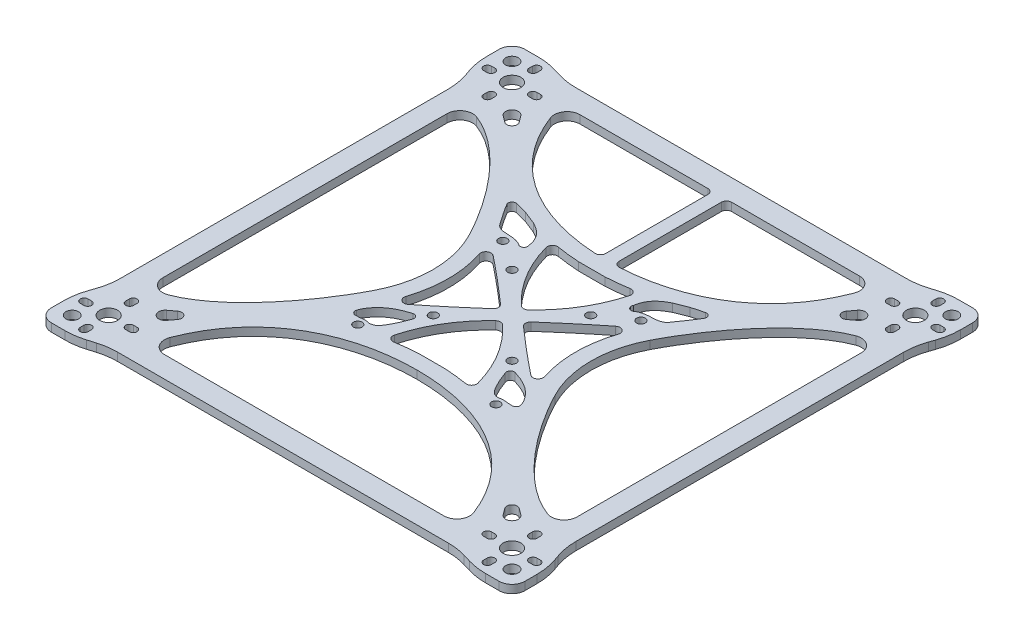
from build123d import *

# Parameters (mm, degrees)
SKETCH2_W                      = 183.5
SKETCH2_H                      = 183.5
BASE_SIZE_DEPTH                = 3.15
BASE_OUTLINE_AND_POCKETS_REACH = 131.792
MOTOR_HOLES_REACH              = 131.792
SKETCH4_R                      = 3.45
FC_HOLES_REACH                 = 131.792
SKETCH5_R                      = 1.675
SKETCH6_R                      = 2.45
SKETCH6_R_2                    = 2
MOTOR_WIRE_HOLES_DEPTH         = 3.15
LARGE_POCKET_FILLET_R          = 40
OUTSIDE_EDGE_FILLET_R          = 25
INNER_POCKET_FILLET_R          = 5
SMALL_POCKET_FILLET_R          = 2
INNER_START                    = -3.15
INNER_POCKETS_DEPTH            = 3.15
POCKET_FILLET_R                = 2


# Read off the part's stored shape, not the designer's step: Inner pockets
with BuildPart() as part:
    # Sketch2 → Base size (new body)
    with BuildSketch(Plane(origin=(0, 0, 0), x_dir=(1, 0, 0), z_dir=(0, 1, 0))):
        Rectangle(SKETCH2_W, SKETCH2_H)
    extrude(amount=BASE_SIZE_DEPTH)

    # Sketch3 → Base outline and pockets (cut, up to next)
    with BuildSketch(Plane(origin=(0, 3.15, 0), x_dir=(1, 0, 0), z_dir=(0, 1, 0)), mode=Mode.PRIVATE) as base_outline_and_pockets_sk1:
        with BuildLine():
            Line((-2.6, 36.790165742), (-2.6, 80.5))
            Line((-2.6, 80.5), (-61, 80.5))
            add(Edge.make_bspline(
                [(-61, 80.5), (-53.080820204, 50.565886756), (-28.566532025, 37.595544557), (-2.6, 36.790165742)],
                knots=[0, 0, 0, 0, 0.96775312, 0.96775312, 0.96775312, 0.96775312], degree=3))
        make_face()
    base_outline_and_pockets_tool1 = extrude(base_outline_and_pockets_sk1.sketch, amount=-BASE_OUTLINE_AND_POCKETS_REACH, mode=Mode.PRIVATE) & part.part
    # Sketch3 → Base outline and pockets (cut, up to next)
    with BuildSketch(Plane(origin=(0, 3.15, 0), x_dir=(1, 0, 0), z_dir=(0, 1, 0)), mode=Mode.PRIVATE) as base_outline_and_pockets_sk2:
        with BuildLine():
            add(Edge.make_bspline(
                [(61, 80.5), (53.080820204, 50.565886756), (28.566532025, 37.595544557), (2.6, 36.790165742)],
                knots=[0, 0, 0, 0, 0.96775312, 0.96775312, 0.96775312, 0.96775312], degree=3))
            Line((61, 80.5), (2.6, 80.5))
            Line((2.6, 80.5), (2.6, 36.790165742))
        make_face()
    base_outline_and_pockets_tool2 = extrude(base_outline_and_pockets_sk2.sketch, amount=-BASE_OUTLINE_AND_POCKETS_REACH, mode=Mode.PRIVATE) & part.part
    # Sketch3 → Base outline and pockets (cut, up to next)
    with BuildSketch(Plane(origin=(0, 3.15, 0), x_dir=(1, 0, 0), z_dir=(0, 1, 0)), mode=Mode.PRIVATE) as base_outline_and_pockets_sk3:
        Polygon((-77.75, 91.75), (-67.75, 88.75), (67.75, 88.75), (77.75, 91.75), align=None)
    base_outline_and_pockets_tool3 = extrude(base_outline_and_pockets_sk3.sketch, amount=-BASE_OUTLINE_AND_POCKETS_REACH, mode=Mode.PRIVATE) & part.part
    # Sketch3 → Base outline and pockets (cut, up to next)
    with BuildSketch(Plane(origin=(0, 3.15, 0), x_dir=(1, 0, 0), z_dir=(0, 1, 0)), mode=Mode.PRIVATE) as base_outline_and_pockets_sk4:
        with BuildLine():
            add(Edge.make_bspline(
                [(-80.25, -61.309782609), (-57.92845796, -59.682798017), (-32.234971436, -20.043544988), (-28, 0)],
                knots=[0, 0, 0, 0, 1, 1, 1, 1], degree=3))
            add(Edge.make_bspline(
                [(-80.25, 61.309782609), (-57.92845796, 59.682798017), (-32.234971436, 20.043544988), (-28, 0)],
                knots=[0, 0, 0, 0, 1, 1, 1, 1], degree=3))
            Line((-80.25, 61.309782609), (-80.25, -61.309782609))
        make_face()
    base_outline_and_pockets_tool4 = extrude(base_outline_and_pockets_sk4.sketch, amount=-BASE_OUTLINE_AND_POCKETS_REACH, mode=Mode.PRIVATE) & part.part
    # Sketch3 → Base outline and pockets (cut, up to next)
    with BuildSketch(Plane(origin=(0, 3.15, 0), x_dir=(1, 0, 0), z_dir=(0, 1, 0)), mode=Mode.PRIVATE) as base_outline_and_pockets_sk5:
        with BuildLine():
            Line((80.25, -61.309782609), (80.25, 61.309782609))
            add(Edge.make_bspline(
                [(80.25, 61.309782609), (57.92845796, 59.682798017), (32.234971436, 20.043544988), (28, 0)],
                knots=[0, 0, 0, 0, 1, 1, 1, 1], degree=3))
            add(Edge.make_bspline(
                [(80.25, -61.309782609), (57.92845796, -59.682798017), (32.234971436, -20.043544988), (28, 0)],
                knots=[0, 0, 0, 0, 1, 1, 1, 1], degree=3))
        make_face()
    base_outline_and_pockets_tool5 = extrude(base_outline_and_pockets_sk5.sketch, amount=-BASE_OUTLINE_AND_POCKETS_REACH, mode=Mode.PRIVATE) & part.part
    # Sketch3 → Base outline and pockets (cut, up to next)
    with BuildSketch(Plane(origin=(0, 3.15, 0), x_dir=(1, 0, 0), z_dir=(0, 1, 0)), mode=Mode.PRIVATE) as base_outline_and_pockets_sk6:
        with BuildLine():
            Line((-61, -80.5), (61, -80.5))
            add(Edge.make_bspline(
                [(61, -80.5), (52.816942117, -49.568440465), (26.914405863, -36.75), (0, -36.75)],
                knots=[0, 0, 0, 0, 1, 1, 1, 1], degree=3))
            add(Edge.make_bspline(
                [(-61, -80.5), (-52.816942117, -49.568440465), (-26.914405863, -36.75), (0, -36.75)],
                knots=[0, 0, 0, 0, 1, 1, 1, 1], degree=3))
        make_face()
    base_outline_and_pockets_tool6 = extrude(base_outline_and_pockets_sk6.sketch, amount=-BASE_OUTLINE_AND_POCKETS_REACH, mode=Mode.PRIVATE) & part.part
    # Sketch3 → Base outline and pockets (cut, up to next)
    with BuildSketch(Plane(origin=(0, 3.15, 0), x_dir=(1, 0, 0), z_dir=(0, 1, 0)), mode=Mode.PRIVATE) as base_outline_and_pockets_sk7:
        Polygon((-91.75, -77.75), (-88.25, -67.75), (-88.25, 67.75), (-91.75, 77.75), align=None)
    base_outline_and_pockets_tool7 = extrude(base_outline_and_pockets_sk7.sketch, amount=-BASE_OUTLINE_AND_POCKETS_REACH, mode=Mode.PRIVATE) & part.part
    # Sketch3 → Base outline and pockets (cut, up to next)
    with BuildSketch(Plane(origin=(0, 3.15, 0), x_dir=(1, 0, 0), z_dir=(0, 1, 0)), mode=Mode.PRIVATE) as base_outline_and_pockets_sk8:
        Polygon((67.75, -88.75), (-67.75, -88.75), (-77.75, -91.75), (77.75, -91.75), align=None)
    base_outline_and_pockets_tool8 = extrude(base_outline_and_pockets_sk8.sketch, amount=-BASE_OUTLINE_AND_POCKETS_REACH, mode=Mode.PRIVATE) & part.part
    # Sketch3 → Base outline and pockets (cut, up to next)
    with BuildSketch(Plane(origin=(0, 3.15, 0), x_dir=(1, 0, 0), z_dir=(0, 1, 0)), mode=Mode.PRIVATE) as base_outline_and_pockets_sk9:
        Polygon((88.25, 67.75), (88.25, -67.75), (91.75, -77.75), (91.75, 77.75), align=None)
    base_outline_and_pockets_tool9 = extrude(base_outline_and_pockets_sk9.sketch, amount=-BASE_OUTLINE_AND_POCKETS_REACH, mode=Mode.PRIVATE) & part.part
    add(base_outline_and_pockets_tool1.solids().sort_by_distance((-26.434062, 3.15, -62.242812))[0], mode=Mode.SUBTRACT)
    add(base_outline_and_pockets_tool2.solids().sort_by_distance((26.434062, 3.15, -62.242812))[0], mode=Mode.SUBTRACT)
    add(base_outline_and_pockets_tool3.solids().sort_by_distance((0, 3.15, -90.284364))[0], mode=Mode.SUBTRACT)
    add(base_outline_and_pockets_tool4.solids().sort_by_distance((-60.183466, 3.15, 0))[0], mode=Mode.SUBTRACT)
    add(base_outline_and_pockets_tool5.solids().sort_by_distance((60.183466, 3.15, 0))[0], mode=Mode.SUBTRACT)
    add(base_outline_and_pockets_tool6.solids().sort_by_distance((0, 3.15, 62.039665))[0], mode=Mode.SUBTRACT)
    add(base_outline_and_pockets_tool7.solids().sort_by_distance((-90.040092, 3.15, 0))[0], mode=Mode.SUBTRACT)
    add(base_outline_and_pockets_tool8.solids().sort_by_distance((0, 3.15, 90.284364))[0], mode=Mode.SUBTRACT)
    add(base_outline_and_pockets_tool9.solids().sort_by_distance((90.040092, 3.15, 0))[0], mode=Mode.SUBTRACT)

    # Sketch4 → Motor holes (cut, up to next)
    with BuildSketch(Plane(origin=(0, 3.15, 0), x_dir=(1, 0, 0), z_dir=(0, 1, 0)), mode=Mode.PRIVATE) as motor_holes_sk1:
        with Locations(Location((78.135299321, 78.135299321, 0), (0, 0, 270))):
            Circle(SKETCH4_R)
    motor_holes_tool1 = extrude(motor_holes_sk1.sketch, amount=-MOTOR_HOLES_REACH, mode=Mode.PRIVATE) & part.part
    # Sketch4 → Motor holes (cut, up to next)
    with BuildSketch(Plane(origin=(0, 3.15, 0), x_dir=(1, 0, 0), z_dir=(0, 1, 0)), mode=Mode.PRIVATE) as motor_holes_sk2:
        with Locations(Location((-78.135299321, 78.135299321, 0), (0, 0, 270))):
            Circle(SKETCH4_R)
    motor_holes_tool2 = extrude(motor_holes_sk2.sketch, amount=-MOTOR_HOLES_REACH, mode=Mode.PRIVATE) & part.part
    # Sketch4 → Motor holes (cut, up to next)
    with BuildSketch(Plane(origin=(0, 3.15, 0), x_dir=(1, 0, 0), z_dir=(0, 1, 0)), mode=Mode.PRIVATE) as motor_holes_sk3:
        with Locations(Location((78.135299321, -78.135299321, 0), (0, 0, 270))):
            Circle(SKETCH4_R)
    motor_holes_tool3 = extrude(motor_holes_sk3.sketch, amount=-MOTOR_HOLES_REACH, mode=Mode.PRIVATE) & part.part
    # Sketch4 → Motor holes (cut, up to next)
    with BuildSketch(Plane(origin=(0, 3.15, 0), x_dir=(1, 0, 0), z_dir=(0, 1, 0)), mode=Mode.PRIVATE) as motor_holes_sk4:
        with Locations(Location((-78.135299321, -78.135299321, 0), (0, 0, 270))):
            Circle(SKETCH4_R)
    motor_holes_tool4 = extrude(motor_holes_sk4.sketch, amount=-MOTOR_HOLES_REACH, mode=Mode.PRIVATE) & part.part
    # Sketch4 → Motor holes (cut, up to next)
    with BuildSketch(Plane(origin=(0, 3.15, 0), x_dir=(1, 0, 0), z_dir=(0, 1, 0)), mode=Mode.PRIVATE) as motor_holes_sk5:
        with BuildLine():
            Line((68.635299321, 79.635299321), (70.010299321, 79.635299321))
            ThreePointArc((70.010299321, 79.635299321), (71.510299321, 78.135299321), (70.010299321, 76.635299321))
            Line((70.010299321, 76.635299321), (68.635299321, 76.635299321))
            ThreePointArc((68.635299321, 76.635299321), (67.135299321, 78.135299321), (68.635299321, 79.635299321))
        make_face()
    motor_holes_tool5 = extrude(motor_holes_sk5.sketch, amount=-MOTOR_HOLES_REACH, mode=Mode.PRIVATE) & part.part
    # Sketch4 → Motor holes (cut, up to next)
    with BuildSketch(Plane(origin=(0, 3.15, 0), x_dir=(1, 0, 0), z_dir=(0, 1, 0)), mode=Mode.PRIVATE) as motor_holes_sk6:
        with BuildLine():
            Line((87.635299321, 79.635299321), (86.260299321, 79.635299321))
            ThreePointArc((86.260299321, 79.635299321), (84.760299321, 78.135299321), (86.260299321, 76.635299321))
            Line((86.260299321, 76.635299321), (87.635299321, 76.635299321))
            ThreePointArc((87.635299321, 76.635299321), (89.135299321, 78.135299321), (87.635299321, 79.635299321))
        make_face()
    motor_holes_tool6 = extrude(motor_holes_sk6.sketch, amount=-MOTOR_HOLES_REACH, mode=Mode.PRIVATE) & part.part
    # Sketch4 → Motor holes (cut, up to next)
    with BuildSketch(Plane(origin=(0, 3.15, 0), x_dir=(1, 0, 0), z_dir=(0, 1, 0)), mode=Mode.PRIVATE) as motor_holes_sk7:
        with BuildLine():
            Line((79.635299321, 68.635299321), (79.635299321, 70.010299321))
            ThreePointArc((79.635299321, 70.010299321), (78.135299321, 71.510299321), (76.635299321, 70.010299321))
            Line((76.635299321, 70.010299321), (76.635299321, 68.635299321))
            ThreePointArc((76.635299321, 68.635299321), (78.135299321, 67.135299321), (79.635299321, 68.635299321))
        make_face()
    motor_holes_tool7 = extrude(motor_holes_sk7.sketch, amount=-MOTOR_HOLES_REACH, mode=Mode.PRIVATE) & part.part
    # Sketch4 → Motor holes (cut, up to next)
    with BuildSketch(Plane(origin=(0, 3.15, 0), x_dir=(1, 0, 0), z_dir=(0, 1, 0)), mode=Mode.PRIVATE) as motor_holes_sk8:
        with BuildLine():
            Line((79.635299321, 87.635299321), (79.635299321, 86.260299321))
            ThreePointArc((79.635299321, 86.260299321), (78.135299321, 84.760299321), (76.635299321, 86.260299321))
            Line((76.635299321, 86.260299321), (76.635299321, 87.635299321))
            ThreePointArc((76.635299321, 87.635299321), (78.135299321, 89.135299321), (79.635299321, 87.635299321))
        make_face()
    motor_holes_tool8 = extrude(motor_holes_sk8.sketch, amount=-MOTOR_HOLES_REACH, mode=Mode.PRIVATE) & part.part
    # Sketch4 → Motor holes (cut, up to next)
    with BuildSketch(Plane(origin=(0, 3.15, 0), x_dir=(1, 0, 0), z_dir=(0, 1, 0)), mode=Mode.PRIVATE) as motor_holes_sk9:
        with BuildLine():
            Line((-68.635299321, 79.635299321), (-70.010299321, 79.635299321))
            ThreePointArc((-70.010299321, 79.635299321), (-71.510299321, 78.135299321), (-70.010299321, 76.635299321))
            Line((-70.010299321, 76.635299321), (-68.635299321, 76.635299321))
            ThreePointArc((-68.635299321, 76.635299321), (-67.135299321, 78.135299321), (-68.635299321, 79.635299321))
        make_face()
    motor_holes_tool9 = extrude(motor_holes_sk9.sketch, amount=-MOTOR_HOLES_REACH, mode=Mode.PRIVATE) & part.part
    # Sketch4 → Motor holes (cut, up to next)
    with BuildSketch(Plane(origin=(0, 3.15, 0), x_dir=(1, 0, 0), z_dir=(0, 1, 0)), mode=Mode.PRIVATE) as motor_holes_sk10:
        with BuildLine():
            Line((-79.635299321, 87.635299321), (-79.635299321, 86.260299321))
            ThreePointArc((-79.635299321, 86.260299321), (-78.135299321, 84.760299321), (-76.635299321, 86.260299321))
            Line((-76.635299321, 86.260299321), (-76.635299321, 87.635299321))
            ThreePointArc((-76.635299321, 87.635299321), (-78.135299321, 89.135299321), (-79.635299321, 87.635299321))
        make_face()
    motor_holes_tool10 = extrude(motor_holes_sk10.sketch, amount=-MOTOR_HOLES_REACH, mode=Mode.PRIVATE) & part.part
    # Sketch4 → Motor holes (cut, up to next)
    with BuildSketch(Plane(origin=(0, 3.15, 0), x_dir=(1, 0, 0), z_dir=(0, 1, 0)), mode=Mode.PRIVATE) as motor_holes_sk11:
        with BuildLine():
            Line((-87.635299321, 79.635299321), (-86.260299321, 79.635299321))
            ThreePointArc((-86.260299321, 79.635299321), (-84.760299321, 78.135299321), (-86.260299321, 76.635299321))
            Line((-86.260299321, 76.635299321), (-87.635299321, 76.635299321))
            ThreePointArc((-87.635299321, 76.635299321), (-89.135299321, 78.135299321), (-87.635299321, 79.635299321))
        make_face()
    motor_holes_tool11 = extrude(motor_holes_sk11.sketch, amount=-MOTOR_HOLES_REACH, mode=Mode.PRIVATE) & part.part
    # Sketch4 → Motor holes (cut, up to next)
    with BuildSketch(Plane(origin=(0, 3.15, 0), x_dir=(1, 0, 0), z_dir=(0, 1, 0)), mode=Mode.PRIVATE) as motor_holes_sk12:
        with BuildLine():
            Line((-79.635299321, 68.635299321), (-79.635299321, 70.010299321))
            ThreePointArc((-79.635299321, 70.010299321), (-78.135299321, 71.510299321), (-76.635299321, 70.010299321))
            Line((-76.635299321, 70.010299321), (-76.635299321, 68.635299321))
            ThreePointArc((-76.635299321, 68.635299321), (-78.135299321, 67.135299321), (-79.635299321, 68.635299321))
        make_face()
    motor_holes_tool12 = extrude(motor_holes_sk12.sketch, amount=-MOTOR_HOLES_REACH, mode=Mode.PRIVATE) & part.part
    # Sketch4 → Motor holes (cut, up to next)
    with BuildSketch(Plane(origin=(0, 3.15, 0), x_dir=(1, 0, 0), z_dir=(0, 1, 0)), mode=Mode.PRIVATE) as motor_holes_sk13:
        with BuildLine():
            Line((-87.635299321, -79.635299321), (-86.260299321, -79.635299321))
            ThreePointArc((-86.260299321, -79.635299321), (-84.760299321, -78.135299321), (-86.260299321, -76.635299321))
            Line((-86.260299321, -76.635299321), (-87.635299321, -76.635299321))
            ThreePointArc((-87.635299321, -76.635299321), (-89.135299321, -78.135299321), (-87.635299321, -79.635299321))
        make_face()
    motor_holes_tool13 = extrude(motor_holes_sk13.sketch, amount=-MOTOR_HOLES_REACH, mode=Mode.PRIVATE) & part.part
    # Sketch4 → Motor holes (cut, up to next)
    with BuildSketch(Plane(origin=(0, 3.15, 0), x_dir=(1, 0, 0), z_dir=(0, 1, 0)), mode=Mode.PRIVATE) as motor_holes_sk14:
        with BuildLine():
            Line((-79.635299321, -68.635299321), (-79.635299321, -70.010299321))
            ThreePointArc((-79.635299321, -70.010299321), (-78.135299321, -71.510299321), (-76.635299321, -70.010299321))
            Line((-76.635299321, -70.010299321), (-76.635299321, -68.635299321))
            ThreePointArc((-76.635299321, -68.635299321), (-78.135299321, -67.135299321), (-79.635299321, -68.635299321))
        make_face()
    motor_holes_tool14 = extrude(motor_holes_sk14.sketch, amount=-MOTOR_HOLES_REACH, mode=Mode.PRIVATE) & part.part
    # Sketch4 → Motor holes (cut, up to next)
    with BuildSketch(Plane(origin=(0, 3.15, 0), x_dir=(1, 0, 0), z_dir=(0, 1, 0)), mode=Mode.PRIVATE) as motor_holes_sk15:
        with BuildLine():
            Line((-68.635299321, -79.635299321), (-70.010299321, -79.635299321))
            ThreePointArc((-70.010299321, -79.635299321), (-71.510299321, -78.135299321), (-70.010299321, -76.635299321))
            Line((-70.010299321, -76.635299321), (-68.635299321, -76.635299321))
            ThreePointArc((-68.635299321, -76.635299321), (-67.135299321, -78.135299321), (-68.635299321, -79.635299321))
        make_face()
    motor_holes_tool15 = extrude(motor_holes_sk15.sketch, amount=-MOTOR_HOLES_REACH, mode=Mode.PRIVATE) & part.part
    # Sketch4 → Motor holes (cut, up to next)
    with BuildSketch(Plane(origin=(0, 3.15, 0), x_dir=(1, 0, 0), z_dir=(0, 1, 0)), mode=Mode.PRIVATE) as motor_holes_sk16:
        with BuildLine():
            Line((-79.635299321, -87.635299321), (-79.635299321, -86.260299321))
            ThreePointArc((-79.635299321, -86.260299321), (-78.135299321, -84.760299321), (-76.635299321, -86.260299321))
            Line((-76.635299321, -86.260299321), (-76.635299321, -87.635299321))
            ThreePointArc((-76.635299321, -87.635299321), (-78.135299321, -89.135299321), (-79.635299321, -87.635299321))
        make_face()
    motor_holes_tool16 = extrude(motor_holes_sk16.sketch, amount=-MOTOR_HOLES_REACH, mode=Mode.PRIVATE) & part.part
    # Sketch4 → Motor holes (cut, up to next)
    with BuildSketch(Plane(origin=(0, 3.15, 0), x_dir=(1, 0, 0), z_dir=(0, 1, 0)), mode=Mode.PRIVATE) as motor_holes_sk17:
        with BuildLine():
            Line((68.635299321, -79.635299321), (70.010299321, -79.635299321))
            ThreePointArc((70.010299321, -79.635299321), (71.510299321, -78.135299321), (70.010299321, -76.635299321))
            Line((70.010299321, -76.635299321), (68.635299321, -76.635299321))
            ThreePointArc((68.635299321, -76.635299321), (67.135299321, -78.135299321), (68.635299321, -79.635299321))
        make_face()
    motor_holes_tool17 = extrude(motor_holes_sk17.sketch, amount=-MOTOR_HOLES_REACH, mode=Mode.PRIVATE) & part.part
    # Sketch4 → Motor holes (cut, up to next)
    with BuildSketch(Plane(origin=(0, 3.15, 0), x_dir=(1, 0, 0), z_dir=(0, 1, 0)), mode=Mode.PRIVATE) as motor_holes_sk18:
        with BuildLine():
            Line((79.635299321, -87.635299321), (79.635299321, -86.260299321))
            ThreePointArc((79.635299321, -86.260299321), (78.135299321, -84.760299321), (76.635299321, -86.260299321))
            Line((76.635299321, -86.260299321), (76.635299321, -87.635299321))
            ThreePointArc((76.635299321, -87.635299321), (78.135299321, -89.135299321), (79.635299321, -87.635299321))
        make_face()
    motor_holes_tool18 = extrude(motor_holes_sk18.sketch, amount=-MOTOR_HOLES_REACH, mode=Mode.PRIVATE) & part.part
    # Sketch4 → Motor holes (cut, up to next)
    with BuildSketch(Plane(origin=(0, 3.15, 0), x_dir=(1, 0, 0), z_dir=(0, 1, 0)), mode=Mode.PRIVATE) as motor_holes_sk19:
        with BuildLine():
            Line((87.635299321, -79.635299321), (86.260299321, -79.635299321))
            ThreePointArc((86.260299321, -79.635299321), (84.760299321, -78.135299321), (86.260299321, -76.635299321))
            Line((86.260299321, -76.635299321), (87.635299321, -76.635299321))
            ThreePointArc((87.635299321, -76.635299321), (89.135299321, -78.135299321), (87.635299321, -79.635299321))
        make_face()
    motor_holes_tool19 = extrude(motor_holes_sk19.sketch, amount=-MOTOR_HOLES_REACH, mode=Mode.PRIVATE) & part.part
    # Sketch4 → Motor holes (cut, up to next)
    with BuildSketch(Plane(origin=(0, 3.15, 0), x_dir=(1, 0, 0), z_dir=(0, 1, 0)), mode=Mode.PRIVATE) as motor_holes_sk20:
        with BuildLine():
            Line((79.635299321, -68.635299321), (79.635299321, -70.010299321))
            ThreePointArc((79.635299321, -70.010299321), (78.135299321, -71.510299321), (76.635299321, -70.010299321))
            Line((76.635299321, -70.010299321), (76.635299321, -68.635299321))
            ThreePointArc((76.635299321, -68.635299321), (78.135299321, -67.135299321), (79.635299321, -68.635299321))
        make_face()
    motor_holes_tool20 = extrude(motor_holes_sk20.sketch, amount=-MOTOR_HOLES_REACH, mode=Mode.PRIVATE) & part.part
    add(motor_holes_tool1.solids().sort_by_distance((78.135299, 3.15, -78.135299))[0], mode=Mode.SUBTRACT)
    add(motor_holes_tool2.solids().sort_by_distance((-78.135299, 3.15, -78.135299))[0], mode=Mode.SUBTRACT)
    add(motor_holes_tool3.solids().sort_by_distance((78.135299, 3.15, 78.135299))[0], mode=Mode.SUBTRACT)
    add(motor_holes_tool4.solids().sort_by_distance((-78.135299, 3.15, 78.135299))[0], mode=Mode.SUBTRACT)
    add(motor_holes_tool5.solids().sort_by_distance((69.322799, 3.15, -78.135299))[0], mode=Mode.SUBTRACT)
    add(motor_holes_tool6.solids().sort_by_distance((86.947799, 3.15, -78.135299))[0], mode=Mode.SUBTRACT)
    add(motor_holes_tool7.solids().sort_by_distance((78.135299, 3.15, -69.322799))[0], mode=Mode.SUBTRACT)
    add(motor_holes_tool8.solids().sort_by_distance((78.135299, 3.15, -86.947799))[0], mode=Mode.SUBTRACT)
    add(motor_holes_tool9.solids().sort_by_distance((-69.322799, 3.15, -78.135299))[0], mode=Mode.SUBTRACT)
    add(motor_holes_tool10.solids().sort_by_distance((-78.135299, 3.15, -86.947799))[0], mode=Mode.SUBTRACT)
    add(motor_holes_tool11.solids().sort_by_distance((-86.947799, 3.15, -78.135299))[0], mode=Mode.SUBTRACT)
    add(motor_holes_tool12.solids().sort_by_distance((-78.135299, 3.15, -69.322799))[0], mode=Mode.SUBTRACT)
    add(motor_holes_tool13.solids().sort_by_distance((-86.947799, 3.15, 78.135299))[0], mode=Mode.SUBTRACT)
    add(motor_holes_tool14.solids().sort_by_distance((-78.135299, 3.15, 69.322799))[0], mode=Mode.SUBTRACT)
    add(motor_holes_tool15.solids().sort_by_distance((-69.322799, 3.15, 78.135299))[0], mode=Mode.SUBTRACT)
    add(motor_holes_tool16.solids().sort_by_distance((-78.135299, 3.15, 86.947799))[0], mode=Mode.SUBTRACT)
    add(motor_holes_tool17.solids().sort_by_distance((69.322799, 3.15, 78.135299))[0], mode=Mode.SUBTRACT)
    add(motor_holes_tool18.solids().sort_by_distance((78.135299, 3.15, 86.947799))[0], mode=Mode.SUBTRACT)
    add(motor_holes_tool19.solids().sort_by_distance((86.947799, 3.15, 78.135299))[0], mode=Mode.SUBTRACT)
    add(motor_holes_tool20.solids().sort_by_distance((78.135299, 3.15, 69.322799))[0], mode=Mode.SUBTRACT)

    # Sketch5 → FC holes (cut, up to next)
    with BuildSketch(Plane(origin=(0, 3.15, 0), x_dir=(1, 0, 0), z_dir=(0, 1, 0)), mode=Mode.PRIVATE) as fc_holes_sk1:
        with BuildLine():
            Line((-26.75, 21.524718312), (-26.75, 23.199718312))
            Line((-26.75, 23.199718312), (-25.075, 23.199718312))
            ThreePointArc((-25.075, 23.199718312), (-27.934403858, 24.384122171), (-26.75, 21.524718312))
        make_face()
    fc_holes_tool1 = extrude(fc_holes_sk1.sketch, amount=-FC_HOLES_REACH, mode=Mode.PRIVATE) & part.part
    # Sketch5 → FC holes (cut, up to next)
    with BuildSketch(Plane(origin=(0, 3.15, 0), x_dir=(1, 0, 0), z_dir=(0, 1, 0)), mode=Mode.PRIVATE) as fc_holes_sk2:
        with BuildLine():
            Line((-25.075, 23.199718312), (-26.75, 23.199718312))
            Line((-26.75, 23.199718312), (-26.75, 21.524718312))
            ThreePointArc((-26.75, 21.524718312), (-25.565596142, 22.015314454), (-25.075, 23.199718312))
        make_face()
    fc_holes_tool2 = extrude(fc_holes_sk2.sketch, amount=-FC_HOLES_REACH, mode=Mode.PRIVATE) & part.part
    # Sketch5 → FC holes (cut, up to next)
    with BuildSketch(Plane(origin=(0, 3.15, 0), x_dir=(1, 0, 0), z_dir=(0, 1, 0)), mode=Mode.PRIVATE) as fc_holes_sk3:
        with BuildLine():
            Line((-26.75, 21.524718312), (-26.75, 23.199718312))
            Line((-26.75, 23.199718312), (-25.075, 23.199718312))
            ThreePointArc((-25.075, 23.199718312), (-27.934403858, 24.384122171), (-26.75, 21.524718312))
        make_face()
    fc_holes_tool3 = extrude(fc_holes_sk3.sketch, amount=-FC_HOLES_REACH, mode=Mode.PRIVATE) & part.part
    # Sketch5 → FC holes (cut, up to next)
    with BuildSketch(Plane(origin=(0, 3.15, 0), x_dir=(1, 0, 0), z_dir=(0, 1, 0)), mode=Mode.PRIVATE) as fc_holes_sk4:
        with BuildLine():
            Line((-25.075, 23.199718312), (-26.75, 23.199718312))
            Line((-26.75, 23.199718312), (-26.75, 21.524718312))
            ThreePointArc((-26.75, 21.524718312), (-25.565596142, 22.015314454), (-25.075, 23.199718312))
        make_face()
    fc_holes_tool4 = extrude(fc_holes_sk4.sketch, amount=-FC_HOLES_REACH, mode=Mode.PRIVATE) & part.part
    # Sketch5 → FC holes (cut, up to next)
    with BuildSketch(Plane(origin=(0, 3.15, 0), x_dir=(1, 0, 0), z_dir=(0, 1, 0)), mode=Mode.PRIVATE) as fc_holes_sk5:
        with Locations(Location((-15.25, 15.25, 0), (0, 0, 270))):
            Circle(SKETCH5_R)
    fc_holes_tool5 = extrude(fc_holes_sk5.sketch, amount=-FC_HOLES_REACH, mode=Mode.PRIVATE) & part.part
    # Sketch5 → FC holes (cut, up to next)
    with BuildSketch(Plane(origin=(0, 3.15, 0), x_dir=(1, 0, 0), z_dir=(0, 1, 0)), mode=Mode.PRIVATE) as fc_holes_sk6:
        with Locations(Location((15.25, 15.25, 0), (0, 0, 270))):
            Circle(SKETCH5_R)
    fc_holes_tool6 = extrude(fc_holes_sk6.sketch, amount=-FC_HOLES_REACH, mode=Mode.PRIVATE) & part.part
    # Sketch5 → FC holes (cut, up to next)
    with BuildSketch(Plane(origin=(0, 3.15, 0), x_dir=(1, 0, 0), z_dir=(0, 1, 0)), mode=Mode.PRIVATE) as fc_holes_sk7:
        with BuildLine():
            ThreePointArc((28.425, 23.199718312), (26.75, 24.874718312), (25.075, 23.199718312))
            Line((25.075, 23.199718312), (26.75, 23.199718312))
            Line((26.75, 23.199718312), (26.75, 21.524718312))
            ThreePointArc((26.75, 21.524718312), (27.934403858, 22.015314454), (28.425, 23.199718312))
        make_face()
    fc_holes_tool7 = extrude(fc_holes_sk7.sketch, amount=-FC_HOLES_REACH, mode=Mode.PRIVATE) & part.part
    # Sketch5 → FC holes (cut, up to next)
    with BuildSketch(Plane(origin=(0, 3.15, 0), x_dir=(1, 0, 0), z_dir=(0, 1, 0)), mode=Mode.PRIVATE) as fc_holes_sk8:
        with BuildLine():
            Line((26.75, 23.199718312), (25.075, 23.199718312))
            ThreePointArc((25.075, 23.199718312), (25.565596142, 22.015314454), (26.75, 21.524718312))
            Line((26.75, 21.524718312), (26.75, 23.199718312))
        make_face()
    fc_holes_tool8 = extrude(fc_holes_sk8.sketch, amount=-FC_HOLES_REACH, mode=Mode.PRIVATE) & part.part
    # Sketch5 → FC holes (cut, up to next)
    with BuildSketch(Plane(origin=(0, 3.15, 0), x_dir=(1, 0, 0), z_dir=(0, 1, 0)), mode=Mode.PRIVATE) as fc_holes_sk9:
        with BuildLine():
            ThreePointArc((28.425, 23.199718312), (26.75, 24.874718312), (25.075, 23.199718312))
            Line((25.075, 23.199718312), (26.75, 23.199718312))
            Line((26.75, 23.199718312), (26.75, 21.524718312))
            ThreePointArc((26.75, 21.524718312), (27.934403858, 22.015314454), (28.425, 23.199718312))
        make_face()
    fc_holes_tool9 = extrude(fc_holes_sk9.sketch, amount=-FC_HOLES_REACH, mode=Mode.PRIVATE) & part.part
    # Sketch5 → FC holes (cut, up to next)
    with BuildSketch(Plane(origin=(0, 3.15, 0), x_dir=(1, 0, 0), z_dir=(0, 1, 0)), mode=Mode.PRIVATE) as fc_holes_sk10:
        with BuildLine():
            Line((26.75, 23.199718312), (25.075, 23.199718312))
            ThreePointArc((25.075, 23.199718312), (25.565596142, 22.015314454), (26.75, 21.524718312))
            Line((26.75, 21.524718312), (26.75, 23.199718312))
        make_face()
    fc_holes_tool10 = extrude(fc_holes_sk10.sketch, amount=-FC_HOLES_REACH, mode=Mode.PRIVATE) & part.part
    # Sketch5 → FC holes (cut, up to next)
    with BuildSketch(Plane(origin=(0, 3.15, 0), x_dir=(1, 0, 0), z_dir=(0, 1, 0)), mode=Mode.PRIVATE) as fc_holes_sk11:
        with BuildLine():
            ThreePointArc((28.425, -33.000281688), (27.934403858, -31.815877829), (26.75, -31.325281688))
            Line((26.75, -31.325281688), (26.75, -33.000281688))
            Line((26.75, -33.000281688), (25.075, -33.000281688))
            ThreePointArc((25.075, -33.000281688), (26.75, -34.675281688), (28.425, -33.000281688))
        make_face()
    fc_holes_tool11 = extrude(fc_holes_sk11.sketch, amount=-FC_HOLES_REACH, mode=Mode.PRIVATE) & part.part
    # Sketch5 → FC holes (cut, up to next)
    with BuildSketch(Plane(origin=(0, 3.15, 0), x_dir=(1, 0, 0), z_dir=(0, 1, 0)), mode=Mode.PRIVATE) as fc_holes_sk12:
        with BuildLine():
            Line((26.75, -33.000281688), (26.75, -31.325281688))
            ThreePointArc((26.75, -31.325281688), (26.275139446, -31.394002617), (25.839243499, -31.594526519))
            ThreePointArc((25.839243499, -31.594526519), (25.278412058, -32.200247982), (25.075, -33.000281688))
            Line((25.075, -33.000281688), (26.75, -33.000281688))
        make_face()
    fc_holes_tool12 = extrude(fc_holes_sk12.sketch, amount=-FC_HOLES_REACH, mode=Mode.PRIVATE) & part.part
    # Sketch5 → FC holes (cut, up to next)
    with BuildSketch(Plane(origin=(0, 3.15, 0), x_dir=(1, 0, 0), z_dir=(0, 1, 0)), mode=Mode.PRIVATE) as fc_holes_sk13:
        with BuildLine():
            ThreePointArc((28.425, -33.000281688), (27.934403858, -31.815877829), (26.75, -31.325281688))
            Line((26.75, -31.325281688), (26.75, -33.000281688))
            Line((26.75, -33.000281688), (25.075, -33.000281688))
            ThreePointArc((25.075, -33.000281688), (26.75, -34.675281688), (28.425, -33.000281688))
        make_face()
    fc_holes_tool13 = extrude(fc_holes_sk13.sketch, amount=-FC_HOLES_REACH, mode=Mode.PRIVATE) & part.part
    # Sketch5 → FC holes (cut, up to next)
    with BuildSketch(Plane(origin=(0, 3.15, 0), x_dir=(1, 0, 0), z_dir=(0, 1, 0)), mode=Mode.PRIVATE) as fc_holes_sk14:
        with BuildLine():
            Line((26.75, -33.000281688), (26.75, -31.325281688))
            ThreePointArc((26.75, -31.325281688), (26.275139446, -31.394002617), (25.839243499, -31.594526519))
            ThreePointArc((25.839243499, -31.594526519), (25.278412058, -32.200247982), (25.075, -33.000281688))
            Line((25.075, -33.000281688), (26.75, -33.000281688))
        make_face()
    fc_holes_tool14 = extrude(fc_holes_sk14.sketch, amount=-FC_HOLES_REACH, mode=Mode.PRIVATE) & part.part
    # Sketch5 → FC holes (cut, up to next)
    with BuildSketch(Plane(origin=(0, 3.15, 0), x_dir=(1, 0, 0), z_dir=(0, 1, 0)), mode=Mode.PRIVATE) as fc_holes_sk15:
        with Locations(Location((15.25, -15.25, 0), (0, 0, 270))):
            Circle(SKETCH5_R)
    fc_holes_tool15 = extrude(fc_holes_sk15.sketch, amount=-FC_HOLES_REACH, mode=Mode.PRIVATE) & part.part
    # Sketch5 → FC holes (cut, up to next)
    with BuildSketch(Plane(origin=(0, 3.15, 0), x_dir=(1, 0, 0), z_dir=(0, 1, 0)), mode=Mode.PRIVATE) as fc_holes_sk16:
        with Locations(Location((-15.25, -15.25, 0), (0, 0, 270))):
            Circle(SKETCH5_R)
    fc_holes_tool16 = extrude(fc_holes_sk16.sketch, amount=-FC_HOLES_REACH, mode=Mode.PRIVATE) & part.part
    # Sketch5 → FC holes (cut, up to next)
    with BuildSketch(Plane(origin=(0, 3.15, 0), x_dir=(1, 0, 0), z_dir=(0, 1, 0)), mode=Mode.PRIVATE) as fc_holes_sk17:
        with BuildLine():
            ThreePointArc((-25.075, -33.000281688), (-25.565596142, -31.815877829), (-26.75, -31.325281688))
            Line((-26.75, -31.325281688), (-26.75, -33.000281688))
            Line((-26.75, -33.000281688), (-25.075, -33.000281688))
        make_face()
    fc_holes_tool17 = extrude(fc_holes_sk17.sketch, amount=-FC_HOLES_REACH, mode=Mode.PRIVATE) & part.part
    # Sketch5 → FC holes (cut, up to next)
    with BuildSketch(Plane(origin=(0, 3.15, 0), x_dir=(1, 0, 0), z_dir=(0, 1, 0)), mode=Mode.PRIVATE) as fc_holes_sk18:
        with BuildLine():
            Line((-26.75, -33.000281688), (-26.75, -31.325281688))
            ThreePointArc((-26.75, -31.325281688), (-27.934403858, -34.184685546), (-25.075, -33.000281688))
            Line((-25.075, -33.000281688), (-26.75, -33.000281688))
        make_face()
    fc_holes_tool18 = extrude(fc_holes_sk18.sketch, amount=-FC_HOLES_REACH, mode=Mode.PRIVATE) & part.part
    # Sketch5 → FC holes (cut, up to next)
    with BuildSketch(Plane(origin=(0, 3.15, 0), x_dir=(1, 0, 0), z_dir=(0, 1, 0)), mode=Mode.PRIVATE) as fc_holes_sk19:
        with BuildLine():
            ThreePointArc((-25.075, -33.000281688), (-25.565596142, -31.815877829), (-26.75, -31.325281688))
            Line((-26.75, -31.325281688), (-26.75, -33.000281688))
            Line((-26.75, -33.000281688), (-25.075, -33.000281688))
        make_face()
    fc_holes_tool19 = extrude(fc_holes_sk19.sketch, amount=-FC_HOLES_REACH, mode=Mode.PRIVATE) & part.part
    # Sketch5 → FC holes (cut, up to next)
    with BuildSketch(Plane(origin=(0, 3.15, 0), x_dir=(1, 0, 0), z_dir=(0, 1, 0)), mode=Mode.PRIVATE) as fc_holes_sk20:
        with BuildLine():
            Line((-26.75, -33.000281688), (-26.75, -31.325281688))
            ThreePointArc((-26.75, -31.325281688), (-27.934403858, -34.184685546), (-25.075, -33.000281688))
            Line((-25.075, -33.000281688), (-26.75, -33.000281688))
        make_face()
    fc_holes_tool20 = extrude(fc_holes_sk20.sketch, amount=-FC_HOLES_REACH, mode=Mode.PRIVATE) & part.part
    add(fc_holes_tool1.solids().sort_by_distance((-26.986964, 3.15, -23.436682))[0], mode=Mode.SUBTRACT)
    add(fc_holes_tool2.solids().sort_by_distance((-26.039108, 3.15, -22.488826))[0], mode=Mode.SUBTRACT)
    add(fc_holes_tool3.solids().sort_by_distance((-26.986964, 3.15, -23.436682))[0], mode=Mode.SUBTRACT)
    add(fc_holes_tool4.solids().sort_by_distance((-26.039108, 3.15, -22.488826))[0], mode=Mode.SUBTRACT)
    add(fc_holes_tool5.solids().sort_by_distance((-15.25, 3.15, -15.25))[0], mode=Mode.SUBTRACT)
    add(fc_holes_tool6.solids().sort_by_distance((15.25, 3.15, -15.25))[0], mode=Mode.SUBTRACT)
    add(fc_holes_tool7.solids().sort_by_distance((26.986964, 3.15, -23.436682))[0], mode=Mode.SUBTRACT)
    add(fc_holes_tool8.solids().sort_by_distance((26.039108, 3.15, -22.488826))[0], mode=Mode.SUBTRACT)
    add(fc_holes_tool9.solids().sort_by_distance((26.986964, 3.15, -23.436682))[0], mode=Mode.SUBTRACT)
    add(fc_holes_tool10.solids().sort_by_distance((26.039108, 3.15, -22.488826))[0], mode=Mode.SUBTRACT)
    add(fc_holes_tool11.solids().sort_by_distance((26.986964, 3.15, 33.237246))[0], mode=Mode.SUBTRACT)
    add(fc_holes_tool12.solids().sort_by_distance((26.039108, 3.15, 32.28939))[0], mode=Mode.SUBTRACT)
    add(fc_holes_tool13.solids().sort_by_distance((26.986964, 3.15, 33.237246))[0], mode=Mode.SUBTRACT)
    add(fc_holes_tool14.solids().sort_by_distance((26.039108, 3.15, 32.28939))[0], mode=Mode.SUBTRACT)
    add(fc_holes_tool15.solids().sort_by_distance((15.25, 3.15, 15.25))[0], mode=Mode.SUBTRACT)
    add(fc_holes_tool16.solids().sort_by_distance((-15.25, 3.15, 15.25))[0], mode=Mode.SUBTRACT)
    add(fc_holes_tool17.solids().sort_by_distance((-26.039108, 3.15, 32.28939))[0], mode=Mode.SUBTRACT)
    add(fc_holes_tool18.solids().sort_by_distance((-26.986964, 3.15, 33.237246))[0], mode=Mode.SUBTRACT)
    add(fc_holes_tool19.solids().sort_by_distance((-26.039108, 3.15, 32.28939))[0], mode=Mode.SUBTRACT)
    add(fc_holes_tool20.solids().sort_by_distance((-26.986964, 3.15, 33.237246))[0], mode=Mode.SUBTRACT)

    # Sketch6 → Motor wire holes (cut)
    with BuildSketch(Plane(origin=(0, 3.15, 0), x_dir=(1, 0, 0), z_dir=(0, 1, 0))):
        with Locations(Location((-85.206367133, 85.206367133, 0), (0, 0, 270))):
            Circle(SKETCH6_R)
        with Locations((-64.983113191, 64.983113191)):
            Circle(SKETCH6_R_2)
        with Locations((-67.210499552, 67.210499552)):
            Circle(SKETCH6_R)
        with Locations(Location((85.206367133, 85.206367133, 0), (0, 0, 270))):
            Circle(SKETCH6_R)
        with Locations((64.983113191, 64.983113191)):
            Circle(SKETCH6_R_2)
        with Locations((67.210499552, 67.210499552)):
            Circle(SKETCH6_R)
        with Locations(Location((85.206367133, -85.206367133, 0), (0, 0, 270))):
            Circle(SKETCH6_R)
        with Locations((67.210499552, -67.210499552)):
            Circle(SKETCH6_R)
        with Locations((64.983113191, -64.983113191)):
            Circle(SKETCH6_R_2)
        with BuildLine():
            Line((68.677654998, -65.248369358), (66.180791107, -63.381374258))
            ThreePointArc((66.180791107, -63.381374258), (66.721513009, -63.994191519), (66.971954662, -64.772140199))
            ThreePointArc((66.971954662, -64.772140199), (67.869339083, -64.850747346), (68.677654998, -65.248369358))
        make_face()
        with BuildLine():
            Line((63.381374258, -66.180791107), (65.248369358, -68.677654998))
            ThreePointArc((65.248369358, -68.677654998), (64.850747346, -67.869339083), (64.772140199, -66.971954662))
            ThreePointArc((64.772140199, -66.971954662), (63.994191519, -66.721513009), (63.381374258, -66.180791107))
        make_face()
        with Locations(Location((-85.206367133, -85.206367133, 0), (0, 0, 270))):
            Circle(SKETCH6_R)
        with Locations((-67.210499552, -67.210499552)):
            Circle(SKETCH6_R)
        with Locations((-64.983113191, -64.983113191)):
            Circle(SKETCH6_R_2)
        with BuildLine():
            Line((-66.180791107, -63.381374258), (-68.677654998, -65.248369358))
            ThreePointArc((-68.677654998, -65.248369358), (-67.869339083, -64.850747346), (-66.971954662, -64.772140199))
            ThreePointArc((-66.971954662, -64.772140199), (-66.721513009, -63.994191519), (-66.180791107, -63.381374258))
        make_face()
        with BuildLine():
            Line((-65.248369358, -68.677654998), (-63.381374258, -66.180791107))
            ThreePointArc((-63.381374258, -66.180791107), (-63.994191519, -66.721513009), (-64.772140199, -66.971954662))
            ThreePointArc((-64.772140199, -66.971954662), (-64.763411444, -67.09108518), (-64.760499552, -67.210499552))
            ThreePointArc((-64.760499552, -67.210499552), (-64.885664184, -67.983571679), (-65.248369358, -68.677654998))
        make_face()
        with BuildLine():
            ThreePointArc((-66.971954662, 64.772140199), (-67.869339083, 64.850747346), (-68.677654998, 65.248369358))
            Line((-68.677654998, 65.248369358), (-66.180791107, 63.381374258))
            ThreePointArc((-66.180791107, 63.381374258), (-66.721513009, 63.994191519), (-66.971954662, 64.772140199))
        make_face()
        with BuildLine():
            Line((-63.381374258, 66.180791107), (-65.248369358, 68.677654998))
            ThreePointArc((-65.248369358, 68.677654998), (-64.885664184, 67.983571679), (-64.760499552, 67.210499552))
            ThreePointArc((-64.760499552, 67.210499552), (-64.763411444, 67.09108518), (-64.772140199, 66.971954662))
            ThreePointArc((-64.772140199, 66.971954662), (-63.994191519, 66.721513009), (-63.381374258, 66.180791107))
        make_face()
        with BuildLine():
            ThreePointArc((64.772140199, 66.971954662), (64.850747346, 67.869339083), (65.248369358, 68.677654998))
            Line((65.248369358, 68.677654998), (63.381374258, 66.180791107))
            ThreePointArc((63.381374258, 66.180791107), (63.994191519, 66.721513009), (64.772140199, 66.971954662))
        make_face()
        with BuildLine():
            ThreePointArc((66.971954662, 64.772140199), (66.721513009, 63.994191519), (66.180791107, 63.381374258))
            Line((66.180791107, 63.381374258), (68.677654998, 65.248369358))
            ThreePointArc((68.677654998, 65.248369358), (67.869339083, 64.850747346), (66.971954662, 64.772140199))
        make_face()
    extrude(amount=-MOTOR_WIRE_HOLES_DEPTH, mode=Mode.SUBTRACT)

    # Large pocket fillet
    # the kernel refuses this fillet: 40 mm, written as the material it adds along each edge
    with BuildSketch(Plane(origin=(28, 3.15, 0), x_dir=(0.36081925840158097, 0, -0.9326357610377874), z_dir=(0, -1, 0)), Plane(origin=(-28, 3.15, 0), x_dir=(-0.36081925840158097, 0, 0.9326357610377874), z_dir=(0, -1, 0))) as large_pocket_fillet_piece_1:
        with BuildLine():
            CenterArc((15.38311723, 39.761861129), LARGE_POCKET_FILLET_R, 221.443803189, 54.811357607)
            Line((-14.60109361, 13.286455556), (-15.200777827, 12.756947445))
            ThreePointArc((-15.200777827, 12.756947445), (-8.270924536, 5.601268526), (-0.436659173, -0.670319899))
            Line((-0.436659173, -0.670319899), (-0.128181256, -0.789664211))
            ThreePointArc((-0.128181256, -0.789664211), (9.887131038, -1.423742116), (19.828538837, -0.795237223))
            Line((19.828538837, -0.795237223), (19.741373708, 0))
        make_face()
    extrude(amount=3.15)

    # Outside edge fillet
    outside_edge_fillet_edges = [part.edges().sort_by_distance(p)[0] for p in [
        (-91.75, 1.575, 77.75),
        (-91.75, 1.575, -77.75),
        (-88.25, 1.575, -67.75),
        (-88.25, 1.575, 67.75),
        (-77.75, 1.575, 91.75),
        (-67.75, 1.575, 88.75),
        (67.75, 1.575, 88.75),
        (77.75, 1.575, 91.75),
        (91.75, 1.575, 77.75),
        (88.25, 1.575, 67.75),
        (88.25, 1.575, -67.75),
        (91.75, 1.575, -77.75),
        (77.75, 1.575, -91.75),
        (67.75, 1.575, -88.75),
        (-67.75, 1.575, -88.75),
        (-77.75, 1.575, -91.75),
    ]]
    fillet(outside_edge_fillet_edges, radius=OUTSIDE_EDGE_FILLET_R)

    # Inner pocket fillet
    inner_pocket_fillet_edges = [part.edges().sort_by_distance(p)[0] for p in [
        (80.25, 1.575, 61.309782609),
        (80.25, 1.575, -61.309782609),
        (-80.25, 1.575, 61.309782609),
        (-80.25, 1.575, -61.309782609),
        (-61, 1.575, 80.5),
        (61, 1.575, 80.5),
        (61, 1.575, -80.5),
        (-61, 1.575, -80.5),
        (-91.75, 1.575, -91.75),
        (91.75, 1.575, -91.75),
        (91.75, 1.575, 91.75),
        (-91.75, 1.575, 91.75),
    ]]
    fillet(inner_pocket_fillet_edges, radius=INNER_POCKET_FILLET_R)

    # Small pocket fillet
    small_pocket_fillet_edges = [part.edges().sort_by_distance(p)[0] for p in [
        (-2.6, 1.575, -36.790165742),
        (2.6, 1.575, -36.790165742),
        (2.6, 1.575, -80.5),
        (-2.6, 1.575, -80.5),
    ]]
    fillet(small_pocket_fillet_edges, radius=SMALL_POCKET_FILLET_R)

    # Inner pockets outline → Inner pockets (cut)
    with BuildSketch(Plane(origin=(0, 3.15, 0), x_dir=(1, 0, 0), z_dir=(0, 1, 0)).offset(INNER_START)):
        with BuildLine():
            add(Edge.make_bspline(
                [(-18.050294939, -20.681612657), (-18.912445448, -23.279910334), (-21.052933641, -28.089325022), (-23.147851029, -30.002450717), (-25.079522295, -30.458784517), (-26.067424453, -30.005186093), (-27.592309933, -30.099523721), (-29.044452694, -30.305045174), (-29.881132445, -30.306021809), (-30.402452153, -30.306021809)],
                knots=[0, 0, 0, 0, 0.49104396, 0.606921478, 0.658583255, 0.729368466, 0.792680684, 0.893561682, 1, 1, 1, 1], degree=3))
            ThreePointArc((-18.050294939, -20.681612657), (-18.263238746, -19.054545581), (-19.838837725, -18.59609145))
            add(Edge.make_bspline(
                [(-19.838837725, -18.59609145), (-22.368585608, -19.366455523), (-27.656872794, -21.390179425), (-31.461264824, -26.687088744), (-31.865528434, -28.475253318)],
                knots=[0, 0, 0, 0, 0.555172405, 1, 1, 1, 1], degree=3))
            ThreePointArc((-31.865528434, -28.475253318), (-31.574235566, -29.742463816), (-30.402452153, -30.306021809))
        make_face()
        with BuildLine():
            add(Edge.make_bspline(
                [(-21.979062734, 24.747851763), (-23.587781309, 25.961048085), (-26.37246745, 26.35403466), (-29.995688999, 26.360475777), (-32.232263912, 27.166206544), (-34.880103099, 31.193212981), (-36.812538835, 33.690104706), (-38.366520623, 36.477185448)],
                knots=[0, 0, 0, 0, 0.266776496, 0.366283359, 0.496008327, 0.559379991, 1, 1, 1, 1], degree=3))
            ThreePointArc((-21.979062734, 24.747851763), (-20.370766531, 25.249586877), (-20.243172588, 26.929490026))
            add(Edge.make_bspline(
                [(-20.243172588, 26.929490026), (-20.829660083, 31.256620803), (-23.646299932, 33.53558046), (-26.925164296, 35.185149657)],
                knots=[0, 0, 0, 0, 0.515353664, 0.515353664, 0.515353664, 0.515353664], degree=3))
            add(Edge.make_bspline(
                [(-31.883058687, 37.163431706), (-30.256637806, 36.439385016), (-28.602352106, 35.780597046), (-26.925164296, 35.185149657)],
                knots=[0.626462356, 0.626462356, 0.626462356, 0.626462356, 0.698675194, 0.698675194, 0.698675194, 0.698675194], degree=3))
            add(Edge.make_bspline(
                [(-31.883058687, 37.163431706), (-33.490805377, 37.67186615), (-35.100791275, 38.076823821), (-36.622721785, 38.405718825)],
                knots=[0.763725808, 0.763725808, 0.763725808, 0.763725808, 1, 1, 1, 1], degree=3))
            ThreePointArc((-36.622721785, 38.405718825), (-38.052172755, 37.94559573), (-38.366520623, 36.477185448))
        make_face()
        with BuildLine():
            ThreePointArc((20.243172588, 26.929490026), (20.370766531, 25.249586877), (21.979062734, 24.747851763))
            add(Edge.make_bspline(
                [(21.979062734, 24.747851763), (23.587781309, 25.961048085), (26.37246745, 26.35403466), (29.995688999, 26.360475777), (32.232263912, 27.166206544), (34.880103099, 31.193212981), (36.812538835, 33.690104706), (38.366520623, 36.477185448)],
                knots=[0, 0, 0, 0, 0.266776496, 0.366283359, 0.496008327, 0.559379991, 1, 1, 1, 1], degree=3))
            ThreePointArc((38.366520623, 36.477185448), (38.052172755, 37.94559573), (36.622721785, 38.405718825))
            add(Edge.make_bspline(
                [(31.883058687, 37.163431706), (33.490805377, 37.67186615), (35.100791275, 38.076823821), (36.622721785, 38.405718825)],
                knots=[0.763725808, 0.763725808, 0.763725808, 0.763725808, 1, 1, 1, 1], degree=3))
            add(Edge.make_bspline(
                [(31.883058687, 37.163431706), (30.256637806, 36.439385016), (28.602352106, 35.780597045), (26.925164297, 35.185149657)],
                knots=[0.626462356, 0.626462356, 0.626462356, 0.626462356, 0.698675194, 0.698675194, 0.698675194, 0.698675194], degree=3))
            add(Edge.make_bspline(
                [(20.243172588, 26.929490026), (20.829660083, 31.256620803), (23.646299932, 33.53558046), (26.925164297, 35.185149657)],
                knots=[0, 0, 0, 0, 0.515353664, 0.515353664, 0.515353664, 0.515353664], degree=3))
        make_face()
        with BuildLine():
            add(Edge.make_bspline(
                [(19.838837725, -18.59609145), (22.368585608, -19.366455523), (27.656872794, -21.390179425), (31.461264824, -26.687088744), (31.865528434, -28.475253318)],
                knots=[0, 0, 0, 0, 0.555172405, 1, 1, 1, 1], degree=3))
            ThreePointArc((19.838837725, -18.59609145), (18.263238746, -19.054545581), (18.050294939, -20.681612657))
            add(Edge.make_bspline(
                [(18.050294939, -20.681612657), (18.912445448, -23.279910334), (21.052933641, -28.089325022), (23.147851029, -30.002450717), (25.079522295, -30.458784517), (26.067424453, -30.005186093), (27.592309933, -30.099523721), (29.044452694, -30.305045174), (29.881132445, -30.306021809), (30.402452153, -30.306021809)],
                knots=[0, 0, 0, 0, 0.49104396, 0.606921478, 0.658583255, 0.729368466, 0.792680684, 0.893561682, 1, 1, 1, 1], degree=3))
            ThreePointArc((30.402452153, -30.306021809), (31.574235566, -29.742463816), (31.865528434, -28.475253318))
        make_face()
        with BuildLine():
            add(Edge.make_bspline(
                [(-16.925, -32.416952459), (-13.147389468, -15.331354719), (0, -3.75)],
                knots=[0, 0, 0, 1, 1, 1], degree=2))
            add(Edge.make_bspline(
                [(-16.925, -32.416952459), (-13.024618062, -31.620656169), (-9.052383993, -31.119704284), (-5.053767545, -30.892533259)],
                knots=[0.838966435, 0.838966435, 0.838966435, 0.838966435, 1, 1, 1, 1], degree=3))
            Line((-5.053767545, -30.892533259), (5.053767545, -30.892533259))
            add(Edge.make_bspline(
                [(16.925, -32.416952459), (13.024618062, -31.620656169), (9.052383993, -31.119704284), (5.053767545, -30.892533259)],
                knots=[0.838966435, 0.838966435, 0.838966435, 0.838966435, 1, 1, 1, 1], degree=3))
            add(Edge.make_bspline(
                [(16.925, -32.416952459), (13.147389468, -15.331354719), (0, -3.75)],
                knots=[0, 0, 0, 1, 1, 1], degree=2))
        make_face()
        with BuildLine():
            add(Edge.make_bspline(
                [(-4.25, 0), (-16.641628362, -11.047154075), (-29.796449209, -21.173237756)],
                knots=[0, 0, 0, 1, 1, 1], degree=2))
            add(Edge.make_bspline(
                [(-4.25, 0), (-16.641628362, 11.047154075), (-29.796449209, 21.173237756)],
                knots=[0, 0, 0, 1, 1, 1], degree=2))
            ThreePointArc((-29.796449209, 21.173237756), (-24.633858566, 0), (-29.796449209, -21.173237756))
        make_face()
        with BuildLine():
            add(Edge.make_bspline(
                [(16.925, 32.416952459), (13.147389468, 15.331354719), (0, 3.75)],
                knots=[0, 0, 0, 1, 1, 1], degree=2))
            add(Edge.make_bspline(
                [(16.925, 32.416952459), (13.024618062, 31.620656169), (9.052383993, 31.119704284), (5.053767545, 30.892533259)],
                knots=[0.838966435, 0.838966435, 0.838966435, 0.838966435, 1, 1, 1, 1], degree=3))
            Line((5.053767545, 30.892533259), (-5.053767545, 30.892533259))
            add(Edge.make_bspline(
                [(-16.925000001, 32.416952459), (-13.024618062, 31.62065617), (-9.052383994, 31.119704284), (-5.053767545, 30.892533259)],
                knots=[0.838966435, 0.838966435, 0.838966435, 0.838966435, 1, 1, 1, 1], degree=3))
            add(Edge.make_bspline(
                [(-16.925000001, 32.416952459), (-13.147389468, 15.331354719), (0, 3.75)],
                knots=[0, 0, 0, 1, 1, 1], degree=2))
        make_face()
        with BuildLine():
            add(Edge.make_bspline(
                [(4.25, 0), (16.641628362, 11.047154075), (29.796449209, 21.173237756)],
                knots=[0, 0, 0, 1, 1, 1], degree=2))
            add(Edge.make_bspline(
                [(4.25, 0), (16.641628362, -11.047154075), (29.796449209, -21.173237756)],
                knots=[0, 0, 0, 1, 1, 1], degree=2))
            ThreePointArc((29.796449209, -21.173237756), (24.633858566, 0), (29.796449209, 21.173237756))
        make_face()
    extrude(amount=INNER_POCKETS_DEPTH, mode=Mode.SUBTRACT)

    # Pocket fillet
    pocket_fillet_edges = [part.edges().sort_by_distance(p)[0] for p in [
        (29.796449209, 1.575, 21.173237756),
        (-29.796449209, 1.575, 21.173237756),
        (4.25, 1.575, 0),
        (29.796449209, 1.575, -21.173237756),
        (-4.25, 1.575, 0),
        (-29.796449209, 1.575, -21.173237756),
        (-16.925, 1.575, 32.416952459),
        (0, 1.575, 3.75),
        (16.925, 1.575, 32.416952459),
        (0, 1.575, -3.75),
        (16.925, 1.575, -32.416952459),
        (-16.925000001, 1.575, -32.416952459),
    ]]
    fillet(pocket_fillet_edges, radius=POCKET_FILLET_R)


solid = part.part
